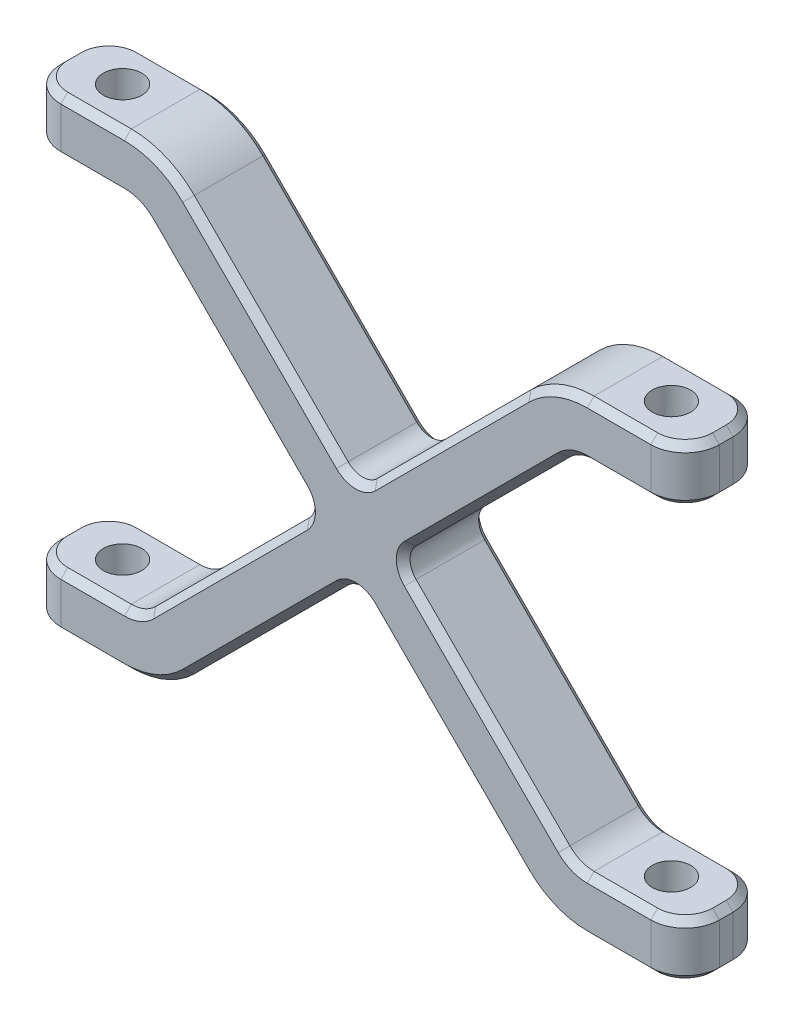
from build123d import *

# Parameters (mm, degrees)
EXTRUIR_L_MINA1_DEPTH    = 6
TALADRO1_D               = 5.6
TALADRO1_DEPTH           = 68
REDONDEO1_R              = 5
REDONDEO1_OF_SIMETR_A1_R = 5
REDONDEO3_R              = 3
CHAFL_N4_SIZE            = 1


# Read off the part's stored shape, not the designer's step: Simetría2
with BuildPart() as part:
    # Croquis1 → Extruir-Lámina1 (new, symmetric)
    with BuildSketch(Plane.XY):
        with BuildLine():
            Line((2.828427125, -2.828427125), (30.192388155, 24.535533906))
            ThreePointArc((30.192388155, 24.535533906), (31.8145049, 25.619397663), (33.727922061, 26))
            Line((33.727922061, 26), (48, 26))
            Line((48, 26), (48, 34))
            Line((48, 34), (33.727922061, 34))
            ThreePointArc((33.727922061, 34), (28.753037441, 33.010433923), (24.535533906, 30.192388155))
            Line((24.535533906, 30.192388155), (-2.828427125, 2.828427125))
            Line((-2.828427125, 2.828427125), (2.828427125, -2.828427125))
        make_face()
    extruir_l_mina1 = extrude(amount=EXTRUIR_L_MINA1_DEPTH, both=True)

    # Taladro1
    with Locations(Plane(origin=(0, 34, 0), x_dir=(1, 0, 0), z_dir=(0, 1, 0))):
        with Locations((40, 0)):
            taladro1 = Hole(TALADRO1_D / 2, depth=TALADRO1_DEPTH)

    # Redondeo1
    redondeo1_edges = [part.edges().sort_by_distance(p)[0] for p in [
        (48, 30, 6),
        (48, 30, -6),
    ]]
    fillet(redondeo1_edges, radius=REDONDEO1_R)

    # Simetría1: Extruir-Lámina1, Taladro1 across plane
    add(extruir_l_mina1.mirror(Plane(origin=(0, 0, 0), x_dir=(0, 0, 1), z_dir=(1, 0, 0))))
    add(taladro1.mirror(Plane(origin=(0, 0, 0), x_dir=(0, 0, 1), z_dir=(1, 0, 0))), mode=Mode.SUBTRACT)

    # Redondeo1 of Simetría1
    redondeo1_of_simetr_a1_edges = [part.edges().sort_by_distance(p)[0] for p in [
        (-48, 30, 6),
        (-48, 30, -6),
    ]]
    fillet(redondeo1_of_simetr_a1_edges, radius=REDONDEO1_OF_SIMETR_A1_R)

    # Simetría2: part across plane


with BuildPart() as part_1:
    add(part.part)
    add(part.part.mirror(Plane.ZX))

    # Redondeo3
    redondeo3_edges = [part_1.edges().sort_by_distance(p)[0] for p in [
        (-5.656854249, 0, 0),
        (5.656854249, 0, 0),
        (0, -5.656854249, 0),
        (0, 5.656854249, 0),
    ]]
    fillet(redondeo3_edges, radius=REDONDEO3_R)

    # Chaflán4
    chafl_n4_edges = [part_1.edges().sort_by_distance(p)[0] for p in [
        (38.363961031, 34, -6),
        (-38.363961031, -26, -6),
        (-31.8145049, -25.619397663, -6),
        (-28.753037441, -33.010433923, 6),
        (-38.363961031, -34, 6),
        (-28.753037441, -33.010433923, -6),
        (-38.363961031, -34, -6),
        (-31.8145049, -25.619397663, 6),
        (-38.363961031, -26, 6),
        (28.753037441, 33.010433923, -6),
        (-48, -26, 0),
        (-46.535533906, -26, 4.535533906),
        (-46.535533906, -26, -4.535533906),
        (-48, -34, 0),
        (-46.535533906, -34, 4.535533906),
        (-46.535533906, -34, -4.535533906),
        (38.363961031, -26, 6),
        (38.363961031, -34, -6),
        (28.753037441, -33.010433923, -6),
        (31.8145049, -25.619397663, 6),
        (31.8145049, -25.619397663, -6),
        (38.363961031, -26, -6),
        (28.753037441, -33.010433923, 6),
        (38.363961031, -34, 6),
        (48, -26, 0),
        (48, -34, 0),
        (38.363961031, 34, 6),
        (46.535533906, -26, 4.535533906),
        (46.535533906, -26, -4.535533906),
        (28.753037441, 33.010433923, 6),
        (46.535533906, -34, 4.535533906),
        (46.535533906, -34, -4.535533906),
        (13.328427125, -18.985281374, 6),
        (13.328427125, -18.985281374, -6),
        (18.985281374, 13.328427125, 6),
        (18.985281374, 13.328427125, -6),
        (18.985281374, -13.328427125, 6),
        (18.985281374, -13.328427125, -6),
        (-18.985281374, 13.328427125, -6),
        (-18.985281374, 13.328427125, 6),
        (-18.985281374, -13.328427125, -6),
        (38.363961031, 26, 6),
        (-18.985281374, -13.328427125, 6),
        (13.328427125, 18.985281374, -6),
        (13.328427125, 18.985281374, 6),
        (-13.328427125, 18.985281374, -6),
        (-13.328427125, -18.985281374, 6),
        (-13.328427125, 18.985281374, 6),
        (0, -6.899494937, -6),
        (0, -6.899494937, 6),
        (31.8145049, 25.619397663, 6),
        (6.899494937, 0, -6),
        (6.899494937, 0, 6),
        (-6.899494937, 0, 6),
        (-6.899494937, 0, -6),
        (0, 6.899494937, 6),
        (0, 6.899494937, -6),
        (-13.328427125, -18.985281374, -6),
        (31.8145049, 25.619397663, -6),
        (38.363961031, 26, -6),
        (48, 26, 0),
        (46.535533906, 26, 4.535533906),
        (46.535533906, 26, -4.535533906),
        (48, 34, 0),
        (46.535533906, 34, 4.535533906),
        (46.535533906, 34, -4.535533906),
        (-31.8145049, 25.619397663, -6),
        (-38.363961031, 26, -6),
        (-28.753037441, 33.010433923, 6),
        (-38.363961031, 34, 6),
        (-38.363961031, 26, 6),
        (-38.363961031, 34, -6),
        (-28.753037441, 33.010433923, -6),
        (-31.8145049, 25.619397663, 6),
        (-48, 26, 0),
        (-48, 34, 0),
        (-46.535533906, 26, 4.535533906),
        (-46.535533906, 26, -4.535533906),
        (-46.535533906, 34, 4.535533906),
        (-46.535533906, 34, -4.535533906),
    ]]
    chamfer(chafl_n4_edges, length=CHAFL_N4_SIZE)


solid = part_1.part
